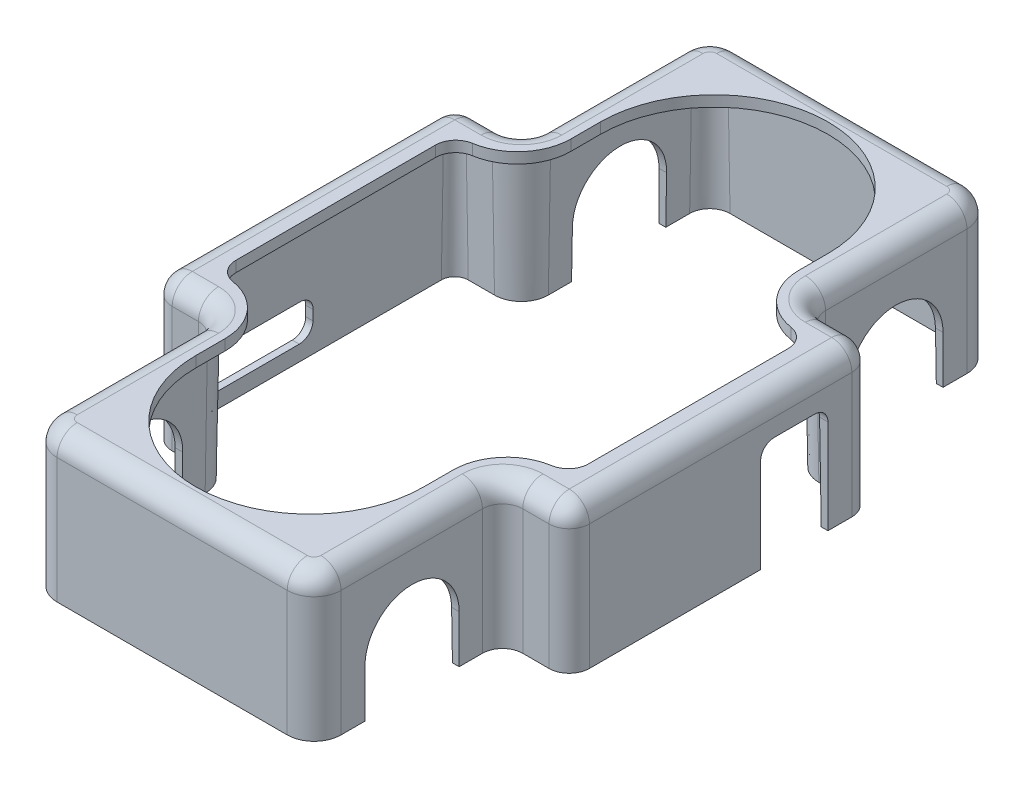
from build123d import *

# Parameters (mm, degrees)
SKETCH1_W           = 310
SKETCH1_H           = 505
BOSS_EXTRUDE1_DEPTH = 108
SKETCH2_W           = 75
SKETCH2_H           = 140
CUT_EXTRUDE1_DEPTH  = 316.349409386
FILLET1_R           = 15
FILLET3_R           = 20
FILLET4_R           = 15
FILLET5_R           = 15
CUT_EXTRUDE2_DEPTH  = 379.524107555
CUT_EXTRUDE3_DEPTH  = 100
CUT_EXTRUDE3_DRAFT  = -1
SKETCH18_W          = 87
SKETCH18_H          = 27.388454903
CUT_EXTRUDE4_DEPTH  = 90
FILLET6_R           = 10
SKETCH19_W          = 50
SKETCH19_H          = 98.394535989
CUT_EXTRUDE5_DEPTH  = 90
FILLET7_R           = 10
CUT_EXTRUDE7_DEPTH  = 90
FILLET12_R          = 40
FILLET13_R          = 15


with BuildPart() as part:
    # Sketch1 → Boss-Extrude1 (new body)
    with BuildSketch(Plane(origin=(0, 0, 0), x_dir=(1, 0, 0), z_dir=(0, 1, 0))):
        Rectangle(SKETCH1_W, SKETCH1_H)
    extrude(amount=BOSS_EXTRUDE1_DEPTH)

    # Sketch2 → Cut-Extrude1 (cut, through all)
    with BuildSketch(Plane(origin=(0, 0, 0), x_dir=(-1, 0, 0), z_dir=(0, -1, 0))):
        with Locations((143, -182.5)):
            Rectangle(SKETCH2_W, SKETCH2_H)
        with Locations((-143, -182.5)):
            Rectangle(SKETCH2_W, SKETCH2_H)
        with Locations((-143, 182.5)):
            Rectangle(SKETCH2_W, SKETCH2_H)
        with Locations((143, 182.5)):
            Rectangle(SKETCH2_W, SKETCH2_H)
    extrude(amount=-CUT_EXTRUDE1_DEPTH, mode=Mode.SUBTRACT)

    # Fillet1
    fillet1_edges = [part.edges().sort_by_distance(p)[0] for p in [
        (-105.5, 54, -112.5),
        (105.5, 54, -112.5),
        (105.5, 54, 112.5),
        (-105.5, 54, 112.5),
    ]]
    fillet(fillet1_edges, radius=FILLET1_R)

    # Fillet3
    fillet3_edges = [part.edges().sort_by_distance(p)[0] for p in [
        (-105.5, 54, -252.5),
        (105.5, 54, -252.5),
        (105.5, 54, 252.5),
        (-105.5, 54, 252.5),
    ]]
    fillet(fillet3_edges, radius=FILLET3_R)

    # Fillet4
    fillet4_edges = [part.edges().sort_by_distance(p)[0] for p in [
        (105.5, 108, 180),
        (0, 108, 252.5),
        (-105.5, 108, -180),
        (0, 108, -252.5),
        (-99.642135624, 108, -246.642135624),
        (99.642135624, 108, -246.642135624),
        (-99.642135624, 108, 246.642135624),
        (99.642135624, 108, 246.642135624),
        (155, 108, 0),
        (-155, 108, 0),
        (137.75, 108, -112.5),
        (-137.75, 108, 112.5),
        (137.75, 108, 112.5),
        (-105.5, 108, 180),
        (105.5, 108, -180),
        (-137.75, 108, -112.5),
        (109.893398282, 108, 116.893398282),
        (-109.893398282, 108, 116.893398282),
        (109.893398282, 108, -116.893398282),
        (-109.893398282, 108, -116.893398282),
    ]]
    fillet(fillet4_edges, radius=FILLET4_R)

    # Fillet5
    # the kernel refuses this fillet: 15 mm, written as the material it takes off along each edge
    with BuildSketch(Plane(origin=(140, 93, -97.5), x_dir=(0, 0, -1), z_dir=(1, 0, 0))) as fillet5_piece_1_section:
        Polygon((0, 0), (FILLET5_R, 0), (FILLET5_R, FILLET5_R), (0, FILLET5_R), align=None)
    fillet5_piece_1 = extrude(amount=FILLET5_R, mode=Mode.PRIVATE)
    fillet5_piece_1 = fillet5_piece_1 - Plane(origin=(140, 93, -97.5), x_dir=(0, -0.7071067811865475, 0.7071067811865475), z_dir=(1, 0, 0)) * Sphere(FILLET5_R, mode=Mode.PRIVATE)
    add(fillet5_piece_1, mode=Mode.SUBTRACT)
    with BuildSketch(Plane(origin=(140, 93, 97.5), x_dir=(1, 0, 0), z_dir=(0, 0, 1))) as fillet5_piece_2_section:
        Polygon((0, 0), (FILLET5_R, 0), (FILLET5_R, FILLET5_R), (0, FILLET5_R), align=None)
    fillet5_piece_2 = extrude(amount=FILLET5_R, mode=Mode.PRIVATE)
    fillet5_piece_2 = fillet5_piece_2 - Plane(origin=(140, 93, 97.5), x_dir=(-0.7071067811865475, -0.7071067811865475, 0), z_dir=(0, 0, 1)) * Sphere(FILLET5_R, mode=Mode.PRIVATE)
    add(fillet5_piece_2, mode=Mode.SUBTRACT)
    with BuildSketch(Plane(origin=(-140, 93, -97.5), x_dir=(0, 0, -1), z_dir=(-1, 0, 0))) as fillet5_piece_3_section:
        Polygon((0, 0), (FILLET5_R, 0), (FILLET5_R, -FILLET5_R), (0, -FILLET5_R), align=None)
    fillet5_piece_3 = extrude(amount=FILLET5_R, mode=Mode.PRIVATE)
    fillet5_piece_3 = fillet5_piece_3 - Plane(origin=(-140, 93, -97.5), x_dir=(0, -0.7071067811865475, 0.7071067811865475), z_dir=(-1, 0, 0)) * Sphere(FILLET5_R, mode=Mode.PRIVATE)
    add(fillet5_piece_3, mode=Mode.SUBTRACT)
    with BuildSketch(Plane(origin=(-140, 93, 97.5), x_dir=(-1, 0, 0), z_dir=(0, 0, 1))) as fillet5_piece_4_section:
        Polygon((0, 0), (FILLET5_R, 0), (FILLET5_R, -FILLET5_R), (0, -FILLET5_R), align=None)
    fillet5_piece_4 = extrude(amount=FILLET5_R, mode=Mode.PRIVATE)
    fillet5_piece_4 = fillet5_piece_4 - Plane(origin=(-140, 93, 97.5), x_dir=(0.7071067811865475, -0.7071067811865475, 0), z_dir=(0, 0, 1)) * Sphere(FILLET5_R, mode=Mode.PRIVATE)
    add(fillet5_piece_4, mode=Mode.SUBTRACT)
    with BuildSketch(Plane(origin=(155, 93, 112.5), x_dir=(-1, 0, 0), z_dir=(0, -1, 0)), Plane(origin=(155, 93, -112.5), x_dir=(0, 0, 1), z_dir=(0, -1, 0))) as fillet5_piece_5:
        with BuildLine():
            CenterArc((FILLET5_R, FILLET5_R), FILLET5_R, 180, 90)
            Line((0, FILLET5_R), (0, 0))
            Line((0, 0), (FILLET5_R, 0))
        make_face()
    extrude(amount=130.5, mode=Mode.SUBTRACT)
    with BuildSketch(Plane(origin=(-155, 93, -112.5), x_dir=(0, 0, 1), z_dir=(0, -1, 0)), Plane(origin=(-155, 93, 112.5), x_dir=(1, 0, 0), z_dir=(0, -1, 0))) as fillet5_piece_6:
        with BuildLine():
            CenterArc((FILLET5_R, -FILLET5_R), FILLET5_R, 90, 90)
            Line((0, -FILLET5_R), (0, 0))
            Line((0, 0), (FILLET5_R, 0))
        make_face()
    extrude(amount=130.5, mode=Mode.SUBTRACT)

    # Sketch16 → Cut-Extrude2 (cut, through all)
    with BuildSketch(Plane.ZY.offset(105.5)):
        with BuildLine():
            Line((-144.75, 35.449402931), (-144.75, -45.449402931))
            ThreePointArc((-144.75, -45.449402931), (-179.75, -80.449402931), (-214.75, -45.449402931))
            Line((-214.75, -45.449402931), (-214.75, 35.449402931))
            ThreePointArc((-214.75, 35.449402931), (-179.75, 70.449402931), (-144.75, 35.449402931))
        make_face()
        with BuildLine():
            Line((144.75, 35.449402931), (144.75, -45.449402931))
            ThreePointArc((144.75, -45.449402931), (179.75, -80.449402931), (214.75, -45.449402931))
            Line((214.75, -45.449402931), (214.75, 35.449402931))
            ThreePointArc((214.75, 35.449402931), (179.75, 70.449402931), (144.75, 35.449402931))
        make_face()
    extrude(amount=-CUT_EXTRUDE2_DEPTH, mode=Mode.SUBTRACT)


with BuildPart() as cut_extrude3_tool:
    # Sketch17 → Cut-Extrude3 (with draft: the straight prism first)
    with BuildSketch(Plane(origin=(0, 0, 0), x_dir=(-1, 0, 0), z_dir=(0, -1, 0))):
        with BuildLine():
            Line((-100.5, -214.75), (-100.5, -232.5))
            ThreePointArc((-100.5, -232.5), (-96.106601718, -243.106601718), (-85.5, -247.5))
            Line((-85.5, -247.5), (85.5, -247.5))
            ThreePointArc((85.5, -247.5), (96.106601718, -243.106601718), (100.5, -232.5))
            Line((100.5, -232.5), (100.5, -214.75))
            Line((100.5, -214.75), (100.5, -144.75))
            Line((100.5, -144.75), (100.5, -127.5))
            ThreePointArc((100.5, -127.5), (106.357864376, -113.357864376), (120.5, -107.5))
            Line((120.5, -107.5), (140, -107.5))
            ThreePointArc((140, -107.5), (147.071067812, -104.571067812), (150, -97.5))
            Line((150, -97.5), (150, 97.5))
            ThreePointArc((150, 97.5), (147.071067812, 104.571067812), (140, 107.5))
            Line((140, 107.5), (120.5, 107.5))
            ThreePointArc((120.5, 107.5), (106.357864376, 113.357864376), (100.5, 127.5))
            Line((100.5, 127.5), (100.5, 144.75))
            Line((100.5, 144.75), (100.5, 214.75))
            Line((100.5, 214.75), (100.5, 232.5))
            ThreePointArc((100.5, 232.5), (96.106601718, 243.106601718), (85.5, 247.5))
            Line((85.5, 247.5), (-85.5, 247.5))
            ThreePointArc((-85.5, 247.5), (-96.106601718, 243.106601718), (-100.5, 232.5))
            Line((-100.5, 232.5), (-100.5, 214.75))
            Line((-100.5, 214.75), (-100.5, 144.75))
            Line((-100.5, 144.75), (-100.5, 127.5))
            ThreePointArc((-100.5, 127.5), (-106.357864376, 113.357864376), (-120.5, 107.5))
            Line((-120.5, 107.5), (-140, 107.5))
            ThreePointArc((-140, 107.5), (-147.071067812, 104.571067812), (-150, 97.5))
            Line((-150, 97.5), (-150, -97.5))
            ThreePointArc((-150, -97.5), (-147.071067812, -104.571067812), (-140, -107.5))
            Line((-140, -107.5), (-120.5, -107.5))
            ThreePointArc((-120.5, -107.5), (-106.357864376, -113.357864376), (-100.5, -127.5))
            Line((-100.5, -127.5), (-100.5, -144.75))
            Line((-100.5, -144.75), (-100.5, -214.75))
        make_face()
    extrude(amount=-CUT_EXTRUDE3_DEPTH)
    # Cut-Extrude3: the draft: its side faces are tilted about the plane it starts from
    cut_extrude3_sides = [cut_extrude3_tool.faces().sort_by_distance(p)[0] for p in [
        (106.357864376, 50, 113.357864376),
        (147.071067812, 50, 104.571067812),
        (150, 50, 0),
        (147.071067812, 50, -104.571067812),
        (130.25, 50, -107.5),
        (106.357864376, 50, -113.357864376),
        (100.5, 50, -180),
        (96.106601718, 50, -243.106601718),
        (0, 50, -247.5),
        (-96.106601718, 50, -243.106601718),
        (-100.5, 50, -180),
        (-106.357864376, 50, -113.357864376),
        (-130.25, 50, -107.5),
        (-147.071067812, 50, -104.571067812),
        (-150, 50, 0),
        (-147.071067812, 50, 104.571067812),
        (-130.25, 50, 107.5),
        (-106.357864376, 50, 113.357864376),
        (-100.5, 50, 180),
        (-96.106601718, 50, 243.106601718),
        (0, 50, 247.5),
        (96.106601718, 50, 243.106601718),
        (100.5, 50, 180),
        (130.25, 50, 107.5),
    ]]
    draft(cut_extrude3_sides, Plane(origin=(0, 0, 0), x_dir=(-1, 0, 0), z_dir=(0, -1, 0)), CUT_EXTRUDE3_DRAFT)


with BuildPart() as part_1:
    add(part.part)

    # Cut-Extrude3: cut by cut_extrude3_tool
    add(cut_extrude3_tool.part, mode=Mode.SUBTRACT)

    # Sketch18 → Cut-Extrude4 (cut)
    with BuildSketch(Plane.ZY.offset(155)):
        with Locations((41.75, 25.394227452)):
            Rectangle(SKETCH18_W, SKETCH18_H)
    extrude(amount=-CUT_EXTRUDE4_DEPTH, mode=Mode.SUBTRACT)

    # Fillet6
    fillet6_edges = [part_1.edges().sort_by_distance(p)[0] for p in [
        (-152.39788787, 11.7, -1.75),
        (-152.158854241, 39.088454903, -1.75),
        (-152.158854241, 39.088454903, 85.25),
        (-152.39788787, 11.7, 85.25),
    ]]
    fillet(fillet6_edges, radius=FILLET6_R)

    # Sketch19 → Cut-Extrude5 (cut)
    with BuildSketch(Plane(origin=(155, 0, 0), x_dir=(0, 0, -1), z_dir=(1, 0, 0))):
        with Locations((54.75, 30.802732005)):
            Rectangle(SKETCH19_W, SKETCH19_H)
    extrude(amount=-CUT_EXTRUDE5_DEPTH, mode=Mode.SUBTRACT)

    # Fillet7
    fillet7_edges = [part_1.edges().sort_by_distance(p)[0] for p in [
        (151.801797403, 80, -29.75),
        (151.801797403, 80, -79.75),
    ]]
    fillet(fillet7_edges, radius=FILLET7_R)

    # Sketch20 → Cut-Extrude7 (cut)
    with BuildSketch(Plane(origin=(0, 108, 0), x_dir=(1, 0, 0), z_dir=(0, 1, 0))):
        with BuildLine():
            Line((-131, -88.5), (-120.5, -88.5))
            ThreePointArc((-120.5, -88.5), (-98.990836138, -94.967618132), (-84.615675262, -112.225340001))
            Line((-84.615675262, -112.225340001), (-84.615675262, -150.25))
            ThreePointArc((-84.615675262, -150.25), (0, -234.865675262), (84.615675262, -150.25))
            Line((84.615675262, -150.25), (84.615675262, -112.225340001))
            ThreePointArc((84.615675262, -112.225340001), (98.990836138, -94.967618132), (120.5, -88.5))
            Line((120.5, -88.5), (131, -88.5))
            Line((131, -88.5), (131, 88.5))
            Line((131, 88.5), (120.5, 88.5))
            ThreePointArc((120.5, 88.5), (98.990836138, 94.967618132), (84.615675262, 112.225340001))
            Line((84.615675262, 112.225340001), (84.615675262, 150.25))
            ThreePointArc((84.615675262, 150.25), (0, 234.865675262), (-84.615675262, 150.25))
            Line((-84.615675262, 150.25), (-84.615675262, 112.225340001))
            ThreePointArc((-84.615675262, 112.225340001), (-98.990836138, 94.967618132), (-120.5, 88.5))
            Line((-120.5, 88.5), (-131, 88.5))
            Line((-131, 88.5), (-131, -88.5))
        make_face()
    extrude(amount=-CUT_EXTRUDE7_DEPTH, mode=Mode.SUBTRACT)

    # Fillet12
    fillet12_edges = [part_1.edges().sort_by_distance(p)[0] for p in [
        (-84.615675262, 104, 112.225340001),
        (84.615675262, 104, 112.225340001),
        (84.615675262, 104, -112.225340001),
        (-84.615675262, 104, -112.225340001),
    ]]
    fillet(fillet12_edges, radius=FILLET12_R)

    # Fillet13
    fillet13_edges = [part_1.edges().sort_by_distance(p)[0] for p in [
        (-131, 104, 88.5),
        (131, 104, -88.5),
        (131, 104, 88.5),
        (-131, 104, -88.5),
    ]]
    fillet(fillet13_edges, radius=FILLET13_R)


solid = part_1.part
